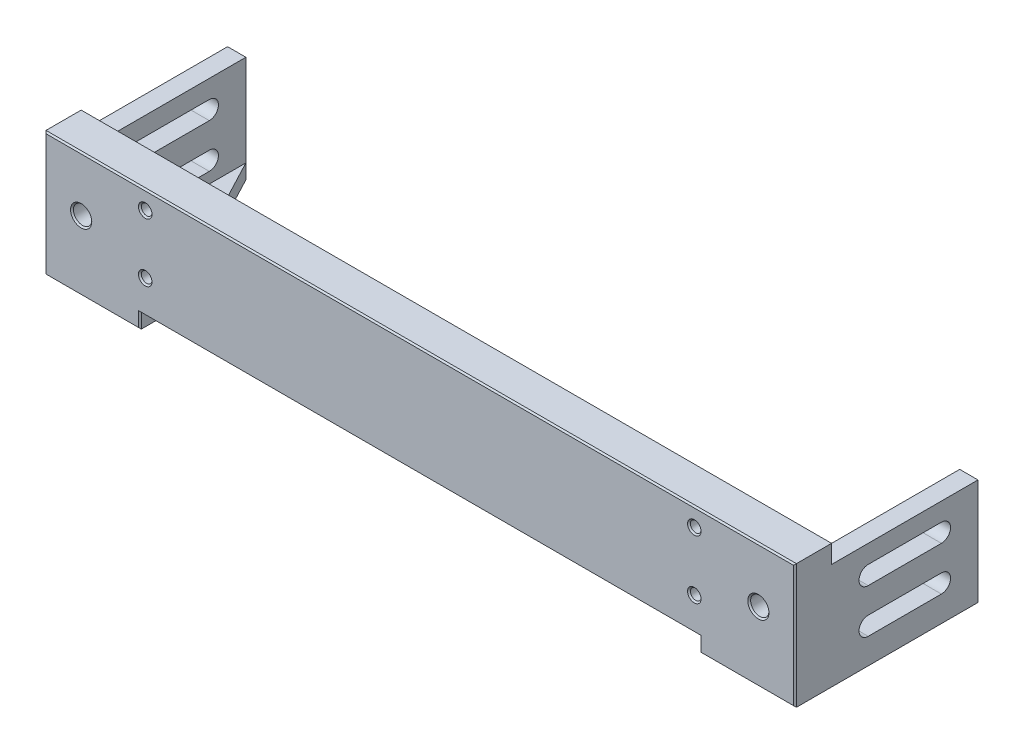
from build123d import *

# Parameters (mm, degrees)
SKETCH1_W           = 260.35
SKETCH1_H           = 38.1
SKETCH1_R           = 3.175
SKETCH1_R_2         = 1.85
BOSS_EXTRUDE1_DEPTH = 12.7
SKETCH2_W           = 6.35
SKETCH2_H           = 31.75
BOSS_EXTRUDE2_DEPTH = 50.8
CUT_EXTRUDE1_DEPTH  = 50.8
BOSS_EXTRUDE3_DEPTH = 5.08
CHAMFER1_SIZE       = 0.5


with BuildPart() as part:
    # Sketch1 → Boss-Extrude1 (new body)
    with BuildSketch(Plane.XY):
        Rectangle(SKETCH1_W, SKETCH1_H)
        with Locations((-117.475, 0)):
            Circle(SKETCH1_R, mode=Mode.SUBTRACT)
        with Locations((117.475, 0)):
            Circle(SKETCH1_R, mode=Mode.SUBTRACT)
        with Locations((-95.25, 12.7)):
            Circle(SKETCH1_R_2, mode=Mode.SUBTRACT)
        with Locations((-95.25, -7.62)):
            Circle(SKETCH1_R_2, mode=Mode.SUBTRACT)
        with Locations((95.25, -7.62)):
            Circle(SKETCH1_R_2, mode=Mode.SUBTRACT)
        with Locations((95.25, 12.7)):
            Circle(SKETCH1_R_2, mode=Mode.SUBTRACT)
    boss_extrude1 = extrude(amount=BOSS_EXTRUDE1_DEPTH)

    # Sketch2 → Boss-Extrude2 (add)
    with BuildSketch(Plane(origin=(0, 0, 0), x_dir=(-1, 0, 0), z_dir=(0, 0, -1))):
        with Locations((-127, -3.175)):
            Rectangle(SKETCH2_W, SKETCH2_H)
    boss_extrude2 = extrude(amount=BOSS_EXTRUDE2_DEPTH)

    # Sketch3 → Cut-Extrude1 (cut)
    with BuildSketch(Plane.ZY.offset(-123.825)):
        with BuildLine():
            Line((-38.1, 6.35), (-12.7, 6.35))
            ThreePointArc((-12.7, 6.35), (-9.525, 3.175), (-12.7, 0))
            Line((-12.7, 0), (-38.1, 0))
            ThreePointArc((-38.1, 0), (-41.275, 3.175), (-38.1, 6.35))
        make_face()
        with BuildLine():
            Line((-38.1, -8.89), (-12.7, -8.89))
            ThreePointArc((-12.7, -8.89), (-9.525, -12.065), (-12.7, -15.24))
            Line((-12.7, -15.24), (-38.1, -15.24))
            ThreePointArc((-38.1, -15.24), (-41.275, -12.065), (-38.1, -8.89))
        make_face()
    cut_extrude1 = extrude(amount=-CUT_EXTRUDE1_DEPTH, mode=Mode.SUBTRACT)

    # Sketch4 → Boss-Extrude3 (add)
    with BuildSketch(Plane(origin=(0, -19.05, 0), x_dir=(-1, 0, 0), z_dir=(0, -1, 0))):
        Polygon((-123.825, 50.8), (-97.1, 0), (-97.1, -12.7), (-130.175, -12.7), (-130.175, 50.8), align=None)
    boss_extrude3 = extrude(amount=BOSS_EXTRUDE3_DEPTH)

    # Mirror1: Boss-Extrude1, Boss-Extrude2, Cut-Extrude1, Boss-Extrude3 across plane
    add(boss_extrude1.mirror(Plane(origin=(0, 0, 0), x_dir=(0, 0, 1), z_dir=(1, 0, 0))))
    add(boss_extrude2.mirror(Plane(origin=(0, 0, 0), x_dir=(0, 0, 1), z_dir=(1, 0, 0))))
    add(cut_extrude1.mirror(Plane(origin=(0, 0, 0), x_dir=(0, 0, 1), z_dir=(1, 0, 0))), mode=Mode.SUBTRACT)
    add(boss_extrude3.mirror(Plane(origin=(0, 0, 0), x_dir=(0, 0, 1), z_dir=(1, 0, 0))))

    # Chamfer1
    chamfer1_edges = [part.edges().sort_by_distance(p)[0] for p in [
        (93.4, 12.7, 12.7),
        (-97.1, 12.7, 12.7),
        (114.3, 0, 12.7),
        (-120.65, 0, 12.7),
        (-97.1, -7.62, 12.7),
        (93.4, -7.62, 12.7),
        (113.6375, -24.13, 12.7),
        (97.1, -21.59, 12.7),
        (0, -19.05, 12.7),
        (-97.1, -21.59, 12.7),
        (-113.6375, -24.13, 12.7),
        (-130.175, -2.54, 12.7),
        (0, 19.05, 12.7),
        (130.175, -2.54, 12.7),
    ]]
    chamfer(chamfer1_edges, length=CHAMFER1_SIZE)


solid = part.part
